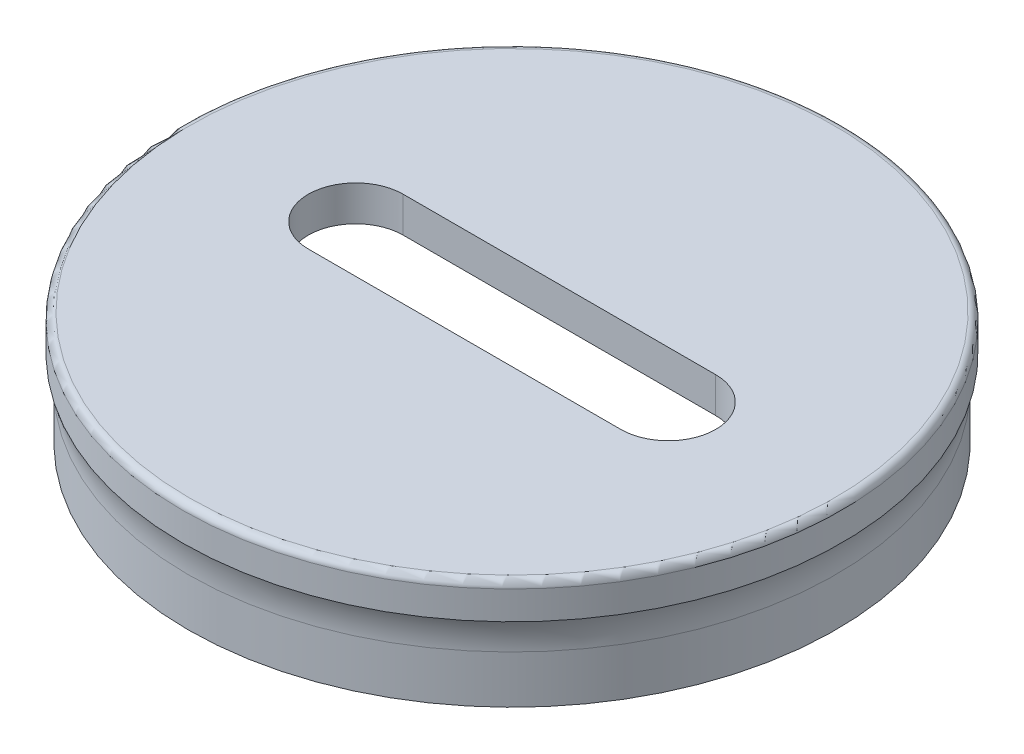
from build123d import *

# Parameters (mm, degrees)
SKETCH1_R           = 58.05
SKETCH1_R_2         = 57.023
BOSS_EXTRUDE1_DEPTH = 13.97
SKETCH2_R           = 59.055
BOSS_EXTRUDE2_DEPTH = 6.35
THREAD1_PITCH       = 3.175
FILLET1_R           = 1.27
FILLET2_R           = 15
SKETCH3_W           = 28
SKETCH3_H           = 8.5
CUT_EXTRUDE1_DEPTH  = 10


with BuildPart() as part:
    # Sketch1 → Boss-Extrude1 (new body)
    with BuildSketch(Plane(origin=(0, 0, 0), x_dir=(1, 0, 0), z_dir=(0, 1, 0))):
        with Locations(Location((0, 0, 0), (0, 0, 270))):
            Circle(SKETCH1_R)
        with Locations(Location((0, 0, 0), (0, 0, 270))):
            Circle(SKETCH1_R_2, mode=Mode.SUBTRACT)
    extrude(amount=BOSS_EXTRUDE1_DEPTH)

    # Sketch2 → Boss-Extrude2 (add)
    with BuildSketch(Plane(origin=(0, 13.97, 0), x_dir=(1, 0, 0), z_dir=(0, 1, 0))):
        with Locations(Location((0, 0, 0), (0, 0, 270))):
            Circle(SKETCH2_R)
    extrude(amount=BOSS_EXTRUDE2_DEPTH)

    # Thread1: arcs per turn and ends read off the stored shape
    # Thread1: the profile of Thread Profile3 profile screwed along a right-hand helix through 2 turns, 12 arcs to a turn; built about Z, then put on its axis
    thread1_z = Axis((0, 0, 0), (0, 0, 1))
    thread1_corners = [(57.0233, 2.5e-08, -0.000173205), (57.0233, 2.5e-08, 2.778298196), (55.304480847, 2.4e-08, 1.785937496), (55.304480847, 2.4e-08, 0.992187496)]
    with BuildLine(mode=Mode.PRIVATE) as thread1_profile:
        Line(thread1_corners[0], thread1_corners[1])
        Line(thread1_corners[1], thread1_corners[2])
        Line(thread1_corners[2], thread1_corners[3])
        Line(thread1_corners[3], thread1_corners[0])
    thread1_cap = Face(thread1_profile.wire())
    thread1_turn_angles = [0, 15, 30, 45, 60, 75, 90, 105, 120, 135, 150, 165, 180, 195, 210, 225, 240, 255, 270, 285, 300, 315, 330, 345, 360]
    thread1_turn_weights = [1, 0.9659258262890683, 1, 0.9659258262890683, 1, 0.9659258262890683, 1, 0.9659258262890683, 1, 0.9659258262890683, 1, 0.9659258262890683, 1, 0.9659258262890683, 1, 0.9659258262890683, 1, 0.9659258262890683, 1, 0.9659258262890683, 1, 0.9659258262890683, 1, 0.9659258262890683, 1]
    thread1_turn_rails = [Edge.make_bspline([Vector(p[0], p[1], 0).rotate(thread1_z, thread1_turn_angles[k]) / thread1_turn_weights[k] + Vector(0, 0, p[2] + THREAD1_PITCH * thread1_turn_angles[k] / 360) for k in range(25)], [0, 0, 0, 1, 1, 2, 2, 3, 3, 4, 4, 5, 5, 6, 6, 7, 7, 8, 8, 9, 9, 10, 10, 11, 11, 12, 12, 12], 2, thread1_turn_weights) for p in thread1_corners]
    thread1_turn_sides = [Face.make_surface_from_curves(thread1_turn_rails[p[0]], thread1_turn_rails[p[1]]) for p in [(0, 1), (1, 2), (2, 3), (3, 0)]]
    thread1 = Plane(origin=(0, 13.97, 0), x_dir=(-0.999847695, 0, -0.017452406), z_dir=(0, -1, 0)) * Solid(Shell([*[p.moved(Location((0, 0, THREAD1_PITCH * i))) for i in range(2) for p in thread1_turn_sides], thread1_cap, thread1_cap.rotate(thread1_z, 720).moved(Location((0, 0, THREAD1_PITCH * 720 / 360)))]))
    add(thread1)

    # Fillet1
    fillet1_edges = [part.edges().sort_by_distance(p)[0] for p in [
        (0, 20.32, -59.055),
    ]]
    fillet(fillet1_edges, radius=FILLET1_R)

    # Fillet2
    # the kernel refuses this fillet: 15 mm, written as the material it adds along each edge
    with BuildSketch(Plane(origin=(0, 13.97, 0), x_dir=(0, 0, 1), z_dir=(-1, 0, 0))) as fillet2_piece_1:
        with BuildLine():
            CenterArc((73.05, -5.398145515), FILLET2_R, 158.907396465, 21.092603535)
            Line((58.05, -5.398145515), (57.75, -5.398145515))
            Line((57.75, -5.398145515), (57.75, 0))
            Line((57.75, 0), (58.05, 0.3))
            ThreePointArc((58.05, 0.3), (58.5525, 0.3), (58.7751, 0.10796291))
            Line((58.7751, 0.10796291), (59.055, 0))
        make_face()
    revolve(axis=Axis((0, 13.97, 0), (0, 1, 0)))

    # Sketch3 → Cut-Extrude1 (cut)
    with BuildSketch(Plane(origin=(0, 20.32, 0), x_dir=(1, 0, 0), z_dir=(0, 1, 0))):
        with BuildLine():
            Line((-28, -8.5), (-28, 0))
            Line((-28, 0), (-36.5, 0))
            ThreePointArc((-36.5, 0), (-34.01040764, -6.01040764), (-28, -8.5))
        make_face()
        with BuildLine():
            Line((-36.5, 0), (-28, 0))
            Line((-28, 0), (-28, 8.5))
            ThreePointArc((-28, 8.5), (-34.01040764, 6.01040764), (-36.5, 0))
        make_face()
        with Locations((-14, 4.25)):
            Rectangle(SKETCH3_W, SKETCH3_H)
        Polygon((0, 8.5), (0, 0), (-28, 0), (-28, -8.5), (28, -8.5), (28, 8.5), align=None)
        with BuildLine():
            ThreePointArc((28, 8.5), (36.5, 0), (28, -8.5))
            Line((28, -8.5), (28, 8.5))
        make_face()
    extrude(amount=-CUT_EXTRUDE1_DEPTH, mode=Mode.SUBTRACT)


solid = part.part
